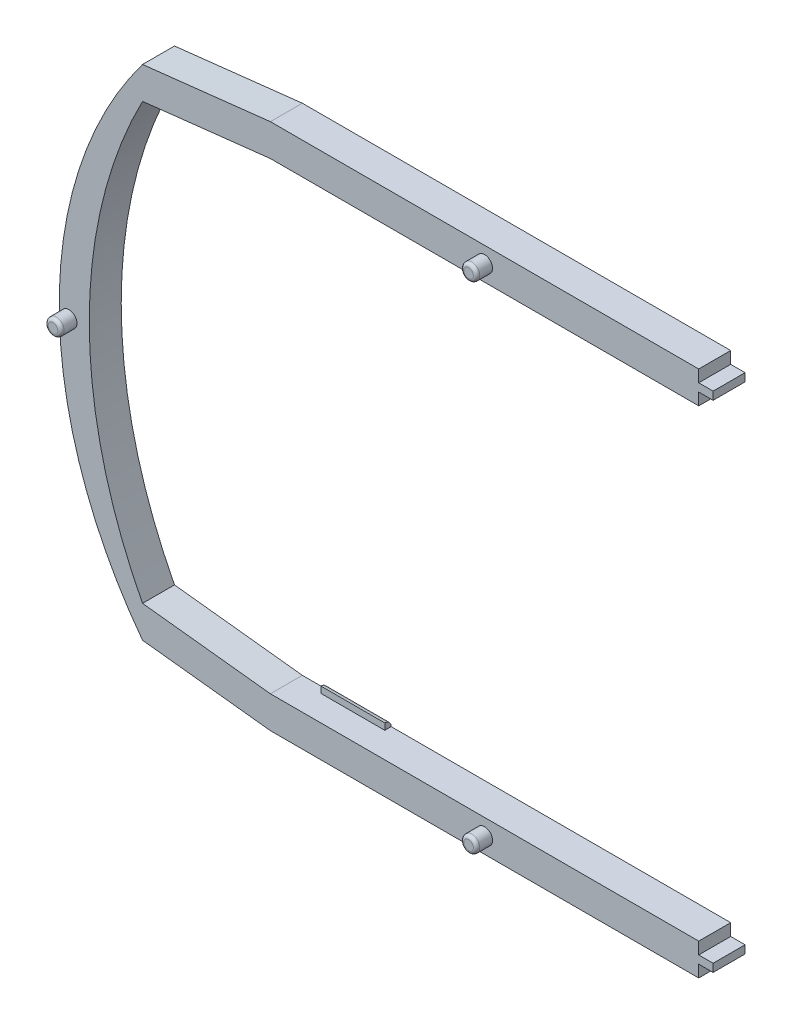
from build123d import *

# Parameters (mm, degrees)
ESQUISSE1_R        = 2.5
ESQUISSE1_W        = 134
ESQUISSE1_H        = 10
BOSS_EXTRU_2_DEPTH = 10
ESQUISSE1_26_W     = 20
ESQUISSE1_26_H     = 2
BOSS_EXTRU_3_DEPTH = 2
ESQUISSE1_27_R     = 2.5
BOSS_EXTRU_4_DEPTH = 15
ESQUISSE1_28_W     = 4.5
ESQUISSE1_28_H     = 2.5
BOSS_EXTRU_5_DEPTH = 10
CONG_1_R           = 1
CONG_2_R           = 1
CONG_3_R           = 1
CONG_4_R           = 2
CONG_5_R           = 2


with BuildPart() as part:
    # Esquisse1 → Boss.-Extru.2 (new body)
    # profile 1 of 7: a face of its own
    with BuildSketch(Plane.XY):
        Polygon((-151.59444934, 48.560080763), (-151.59444934, 38.560080763), (-143.805852374, 38.560080763), (-123.805852374, 38.560080763), (-17.59444934, 38.560080763), (-17.59444934, 42.310080763), (-17.59444934, 44.810080763), (-17.59444934, 48.560080763), align=None)
        with Locations((-84.59444934, 43.560080763)):
            Circle(ESQUISSE1_R, mode=Mode.SUBTRACT)
    # profile 2 of 7: a face of its own
    with BuildSketch(Plane.XY):
        Polygon((-191.59444934, 38.560080763), (-151.59444934, 38.560080763), (-151.59444934, 48.560080763), (-191.59444934, 44.060080763), align=None)
    # profile 3 of 7: a face of its own
    with BuildSketch(Plane.XY):
        with BuildLine():
            ThreePointArc((-191.59444934, -101.939919237), (-208.258682651, -33.939919237), (-191.59444934, 34.060080763))
            Line((-191.59444934, 34.060080763), (-191.59444934, 38.560080763))
            Line((-191.59444934, 38.560080763), (-191.59444934, 44.060080763))
            ThreePointArc((-191.59444934, 44.060080763), (-217.658663565, -33.939919237), (-191.59444934, -111.939919237))
            Line((-191.59444934, -111.939919237), (-191.59444934, -106.439919237))
            Line((-191.59444934, -106.439919237), (-191.59444934, -101.939919237))
        make_face()
        with Locations((-214.593861295, -36.363237388)):
            Circle(ESQUISSE1_R, mode=Mode.SUBTRACT)
    # profile 4 of 7: a face of its own
    with BuildSketch(Plane.XY):
        Polygon((-191.59444934, 38.560080763), (-191.59444934, 34.060080763), (-151.59444934, 38.560080763), align=None)
    # profile 5 of 7: a face of its own
    with BuildSketch(Plane.XY):
        Polygon((-191.59444934, -111.939919237), (-191.59444934, -106.439919237), (-151.59444934, -106.439919237), (-151.59444934, -116.439919237), align=None)
    # profile 6 of 7: a face of its own
    with BuildSketch(Plane.XY):
        Polygon((-151.59444934, -106.439919237), (-191.59444934, -101.939919237), (-191.59444934, -106.439919237), align=None)
    # profile 7 of 7: a face of its own
    with BuildSketch(Plane.XY):
        with Locations((-84.59444934, -111.439919237)):
            Rectangle(ESQUISSE1_W, ESQUISSE1_H)
        with Locations((-84.59444934, -111.439919237)):
            Circle(ESQUISSE1_R, mode=Mode.SUBTRACT)
    extrude(amount=BOSS_EXTRU_2_DEPTH)

    # Esquisse1<26> → Boss.-Extru.3 (add)
    with BuildSketch(Plane.XY):
        with Locations((-133.805852374, -105.439919237)):
            Rectangle(ESQUISSE1_26_W, ESQUISSE1_26_H)
        with Locations((-133.805852374, 37.560080763)):
            Rectangle(ESQUISSE1_26_W, ESQUISSE1_26_H)
    extrude(amount=BOSS_EXTRU_3_DEPTH)

    # Esquisse1<27> → Boss.-Extru.4 (add)
    with BuildSketch(Plane.XY):
        with Locations((-214.593861295, -36.363237388)):
            Circle(ESQUISSE1_27_R)
        with Locations((-84.59444934, 43.560080763)):
            Circle(ESQUISSE1_27_R)
        with Locations((-84.59444934, -111.439919237)):
            Circle(ESQUISSE1_27_R)
    extrude(amount=BOSS_EXTRU_4_DEPTH)

    # Esquisse1<28> → Boss.-Extru.5 (add)
    with BuildSketch(Plane.XY):
        with Locations((-15.34444934, 43.560080763)):
            Rectangle(ESQUISSE1_28_W, ESQUISSE1_28_H)
        with Locations((-15.34444934, -111.439919237)):
            Rectangle(ESQUISSE1_28_W, ESQUISSE1_28_H)
    extrude(amount=BOSS_EXTRU_5_DEPTH)

    # Congé1
    cong_1_edges = [part.edges().sort_by_distance(p)[0] for p in [
        (-87.09444934, 43.560080763, 15),
    ]]
    fillet(cong_1_edges, radius=CONG_1_R)

    # Congé2
    cong_2_edges = [part.edges().sort_by_distance(p)[0] for p in [
        (-87.09444934, -111.439919237, 15),
    ]]
    fillet(cong_2_edges, radius=CONG_2_R)

    # Congé3
    cong_3_edges = [part.edges().sort_by_distance(p)[0] for p in [
        (-217.093861295, -36.363237388, 15),
    ]]
    fillet(cong_3_edges, radius=CONG_3_R)

    # Congé4
    cong_4_edges = [part.edges().sort_by_distance(p)[0] for p in [
        (-133.805852374, -104.439919237, 0),
    ]]
    fillet(cong_4_edges, radius=CONG_4_R - 0.0001)  # a hair under: the kernel refuses the full size

    # Congé5
    cong_5_edges = [part.edges().sort_by_distance(p)[0] for p in [
        (-133.805852374, 36.560080763, 0),
    ]]
    fillet(cong_5_edges, radius=CONG_5_R - 0.0001)  # a hair under: the kernel refuses the full size


solid = part.part
